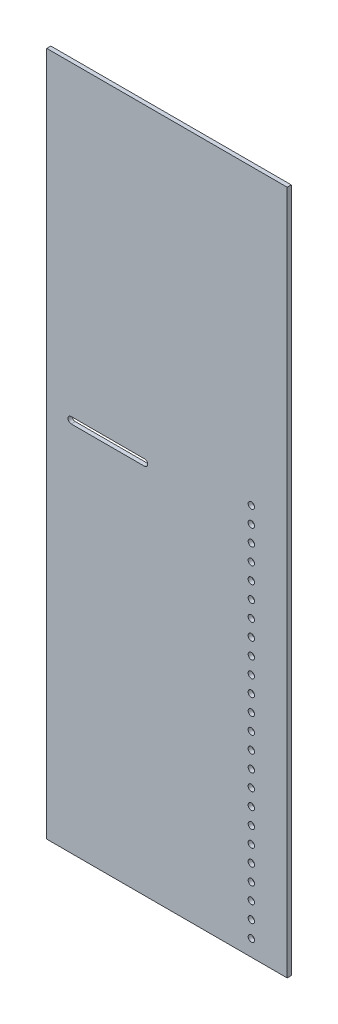
from build123d import *

# Parameters (mm, degrees)
SKETCH1_W                  = 533.4
SKETCH1_H                  = 187.325
BOSS_EXTRUDE1_DEPTH        = 3.175
CUT_EXTRUDE1_DEPTH         = 283.686459759
F_9_0_196_DIAMETER_HOLE1_D = 4.9784


with BuildPart() as part:
    # Sketch1 → Boss-Extrude1 (new body)
    with BuildSketch(Plane(origin=(0, 0, 0), x_dir=(0, 1, 0), z_dir=(0, 0, 1))):
        Rectangle(SKETCH1_W, SKETCH1_H)
    extrude(amount=BOSS_EXTRUDE1_DEPTH)

    # Sketch2 → Cut-Extrude1 (cut, through all)
    with BuildSketch(Plane.XY.offset(3.175)):
        with BuildLine():
            Line((-74.6125, 22.9108), (-17.4625, 22.9108))
            ThreePointArc((-17.4625, 22.9108), (-14.9733, 25.4), (-17.4625, 27.8892))
            Line((-17.4625, 27.8892), (-74.6125, 27.8892))
            ThreePointArc((-74.6125, 27.8892), (-77.1017, 25.4), (-74.6125, 22.9108))
        make_face()
    extrude(amount=-CUT_EXTRUDE1_DEPTH, mode=Mode.SUBTRACT)

    # #9 (0.196) Diameter Hole1 (through all)
    with Locations(Plane.XY.offset(3.175)):
        with Locations((65.7225, -254), (65.7225, -241.3), (65.7225, -228.6), (65.7225, -215.9), (65.7225, -203.2), (65.7225, -190.5), (65.7225, -177.8), (65.7225, -165.1), (65.7225, -152.4), (65.7225, -139.7), (65.7225, -127), (65.7225, -114.3), (65.7225, -101.6), (65.7225, -88.9), (65.7225, -76.2), (65.7225, -63.5), (65.7225, -50.8), (65.7225, -38.1), (65.7225, -25.4), (65.7225, -12.7), (65.7225, 0), (65.7225, 12.7), (65.7225, 25.4), (65.7225, 38.1)):
            Hole(F_9_0_196_DIAMETER_HOLE1_D / 2)


solid = part.part
